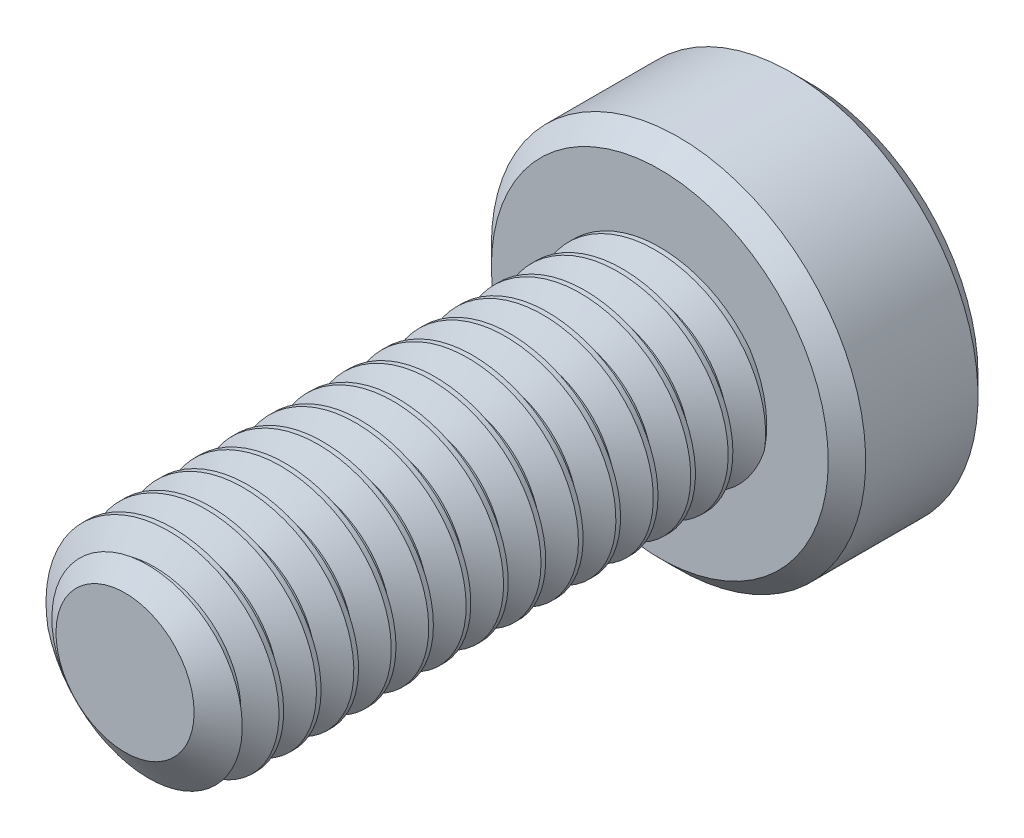
from build123d import *

# Parameters (mm, degrees)
SKETCH1_R          = 2
EXTRUDE1_DEPTH     = 10
CUT_SWEEP1_PITCH   = 0.7
SKETCH6_R          = 3.5
EXTRUDE2_DEPTH     = 2.8
CUT_EXTRUDE1_DEPTH = 1.875
CHAMFER1_SIZE      = 0.35


with BuildPart() as part:
    # Sketch1 → Extrude1 (new body)
    with BuildSketch(Plane.XY):
        Circle(SKETCH1_R)
    extrude(amount=-EXTRUDE1_DEPTH)

    # Cut-Sweep1: the profile of Sketch3 profile screwed along a right-hand helix of 15.285714 turns, 6 arcs to a turn; built about Z, then put on its axis
    cut_sweep1_z = Axis((0, 0, 0), (0, 0, 1))
    cut_sweep1_corners = [(2.0003, 0, -0.612673205), (1.545336663, 0, -0.35), (1.545336663, 0, -0.2625), (2.0003, 0, 0.000173205)]
    with BuildLine(mode=Mode.PRIVATE) as cut_sweep1_profile:
        Line(cut_sweep1_corners[0], cut_sweep1_corners[1])
        Line(cut_sweep1_corners[1], cut_sweep1_corners[2])
        Line(cut_sweep1_corners[2], cut_sweep1_corners[3])
        Line(cut_sweep1_corners[3], cut_sweep1_corners[0])
    cut_sweep1_cap = Face(cut_sweep1_profile.wire())
    cut_sweep1_turn_angles = [0, 30, 60, 90, 120, 150, 180, 210, 240, 270, 300, 330, 360]
    cut_sweep1_turn_weights = [1, 0.8660254037844387, 1, 0.8660254037844387, 1, 0.8660254037844387, 1, 0.8660254037844387, 1, 0.8660254037844387, 1, 0.8660254037844387, 1]
    cut_sweep1_turn_rails = [Edge.make_bspline([Vector(p[0], p[1], 0).rotate(cut_sweep1_z, cut_sweep1_turn_angles[k]) / cut_sweep1_turn_weights[k] + Vector(0, 0, p[2] + CUT_SWEEP1_PITCH * cut_sweep1_turn_angles[k] / 360) for k in range(13)], [0, 0, 0, 1, 1, 2, 2, 3, 3, 4, 4, 5, 5, 6, 6, 6], 2, cut_sweep1_turn_weights) for p in cut_sweep1_corners]
    cut_sweep1_turn_sides = [Face.make_surface_from_curves(cut_sweep1_turn_rails[p[0]], cut_sweep1_turn_rails[p[1]]) for p in [(0, 1), (1, 2), (2, 3), (3, 0)]]
    cut_sweep1_last_angles = [5400, 5430, 5460, 5481.428571429, 5502.857142857]
    cut_sweep1_last_weights = [1, 0.8660254037844387, 1, 0.9308737486442353, 1]
    cut_sweep1_last_rails = [Edge.make_bspline([Vector(p[0], p[1], 0).rotate(cut_sweep1_z, cut_sweep1_last_angles[k]) / cut_sweep1_last_weights[k] + Vector(0, 0, p[2] + CUT_SWEEP1_PITCH * cut_sweep1_last_angles[k] / 360) for k in range(5)], [0, 0, 0, 1, 1, 2, 2, 2], 2, cut_sweep1_last_weights) for p in cut_sweep1_corners]
    cut_sweep1_last_sides = [Face.make_surface_from_curves(cut_sweep1_last_rails[p[0]], cut_sweep1_last_rails[p[1]]) for p in [(0, 1), (1, 2), (2, 3), (3, 0)]]
    cut_sweep1 = Plane(origin=(0, 0, 0), x_dir=(0, 1, 0), z_dir=(0, 0, -1)) * Solid(Shell([*[p.moved(Location((0, 0, CUT_SWEEP1_PITCH * i))) for i in range(15) for p in cut_sweep1_turn_sides], *cut_sweep1_last_sides, cut_sweep1_cap, cut_sweep1_cap.rotate(cut_sweep1_z, 5502.857142857).moved(Location((0, 0, CUT_SWEEP1_PITCH * 5502.857142857 / 360)))]))
    add(cut_sweep1, mode=Mode.SUBTRACT)

    # Sketch4 → Cut-Revolve1 (revolve, cut)
    with BuildSketch(Plane(origin=(0, 0, 0), x_dir=(0, 0, -1), z_dir=(1, 0, 0)), mode=Mode.PRIVATE) as cut_revolve1_sk:
        Polygon((0.496211411, 2), (0, 1.291336663), (0, 2), align=None)
    revolve(cut_revolve1_sk.sketch.rotate(Axis((0, 0, 0), (0, 0, -1)), 271.401126896), axis=Axis((0, 0, 0), (0, 0, -1)), mode=Mode.SUBTRACT)

    # Sketch6 → Extrude2 (add)
    with BuildSketch(Plane(origin=(0, 0, -10), x_dir=(-1, 0, 0), z_dir=(0, 0, -1))):
        Circle(SKETCH6_R)
    extrude(amount=EXTRUDE2_DEPTH)

    # Sketch7 → Cut-Extrude1 (cut)
    with BuildSketch(Plane(origin=(0, 0, -12.8), x_dir=(-1, 0, 0), z_dir=(0, 0, -1))):
        Polygon((0, 1.443375673), (-1.25, 0.721687836), (-1.25, -0.721687836), (0, -1.443375673), (1.25, -0.721687836), (1.25, 0.721687836), align=None)
    extrude(amount=-CUT_EXTRUDE1_DEPTH, mode=Mode.SUBTRACT)

    # Cut-Extrude2 cone 1 section (through the dimple's axis) → Cut-Extrude2 (revolve, cut)
    with BuildSketch(Plane(origin=(0, 0, -12.8), x_dir=(0, 1, 0), z_dir=(1, 0, 0))):
        Polygon((0, 0), (1.443375673, 0), (0, 1.443375673), align=None)
    revolve(axis=Axis((0, 0, -12.8), (0, 0, 1)), mode=Mode.SUBTRACT)

    # Chamfer1
    chamfer1_edges = [part.edges().sort_by_distance(p)[0] for p in [
        (3.5, 0, -10),
        (3.5, 0, -12.8),
    ]]
    chamfer(chamfer1_edges, length=CHAMFER1_SIZE)


solid = part.part
